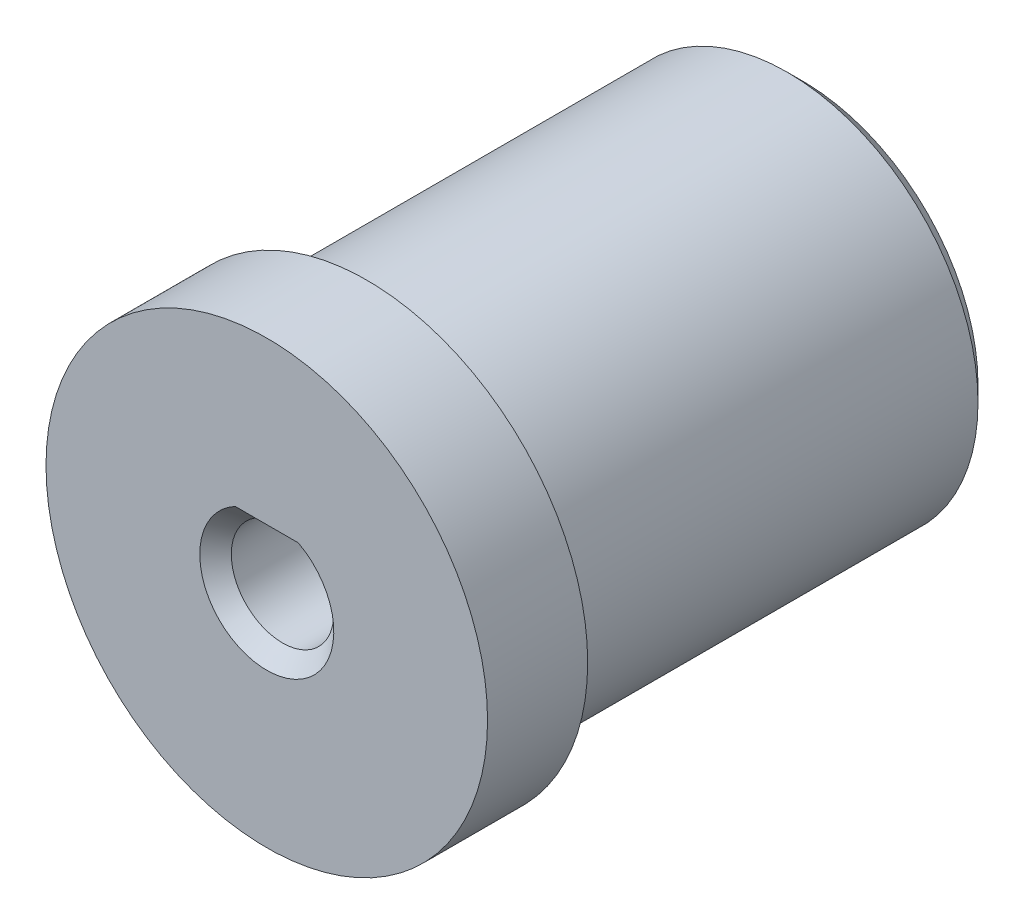
from build123d import *

# Parameters (mm, degrees)
SKETCH2_R           = 12.1
BOSS_EXTRUDE1_DEPTH = 34
BOSS_EXTRUDE2_START = -6.35
SKETCH3_R           = 14
BOSS_EXTRUDE2_DEPTH = 6.35
CHAMFER1_SIZE       = 1


with BuildPart() as part:
    # Sketch2 → Boss-Extrude1 (new body)
    with BuildSketch(Plane.XY):
        Circle(SKETCH2_R)
        with BuildLine():
            Line((-1.732050808, 2.75), (1.732050808, 2.75))
            ThreePointArc((1.732050808, 2.75), (0, -3.25), (-1.732050808, 2.75))
        make_face(mode=Mode.SUBTRACT)
    extrude(amount=BOSS_EXTRUDE1_DEPTH)

    # Sketch3 → Boss-Extrude2 (add)
    with BuildSketch(Plane.XY.offset(34).offset(BOSS_EXTRUDE2_START)):
        Circle(SKETCH3_R)
        with BuildLine():
            ThreePointArc((1.732050808, 2.75), (0, -3.25), (-1.732050808, 2.75))
            Line((-1.732050808, 2.75), (1.732050808, 2.75))
        make_face(mode=Mode.SUBTRACT)
    extrude(amount=BOSS_EXTRUDE2_DEPTH)

    # Chamfer1
    chamfer1_edges = [part.edges().sort_by_distance(p)[0] for p in [
        (0, 2.75, 0),
        (0, -3.25, 0),
        (-12.1, 0, 0),
        (0, -3.25, 34),
        (0, 2.75, 34),
    ]]
    chamfer(chamfer1_edges, length=CHAMFER1_SIZE)


solid = part.part
